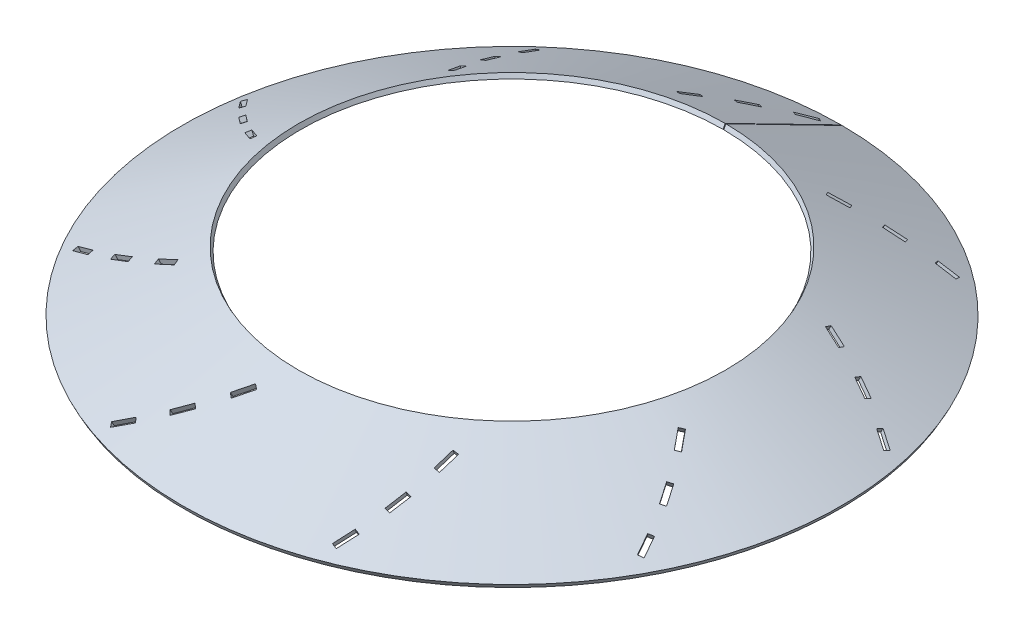
from build123d import *

# Parameters (mm, degrees)
LOFTED_BENDS1_ANGLE = 359.8
CUT_EXTRUDE1_REACH  = 314.369
CIRPATTERN1_COUNT   = 9


# Read off the part's stored shape, not the designer's step: Lofted Bends1
with BuildPart() as part:
    # Lofted Bends1 outline → Lofted Bends1 (revolve)
    with BuildSketch(Plane(origin=(0, 0, 0), x_dir=(-0.0017453283658983838, 0, -0.9999984769132877), z_dir=(0.9999984769132877, 0, -0.0017453283658983838))):
        Polygon((115, 122), (113.860654304, 119.774715437), (176.360654304, 87.774715437), (177.5, 90), align=None)
    revolve(axis=Axis((0, 0, 0), (0, 1, 0)), revolution_arc=LOFTED_BENDS1_ANGLE)

    # Cut-Extrude1: up to this cone (the profile starts outside it)
    cut_extrude1_end = Plane(origin=(0, 104.2342555, 0), z_dir=(0, -1, 0)).offset(-73.837113941) * Cone(1.953e-06, 1061.918172969, 543.70210356, align=(Align.CENTER, Align.CENTER, Align.MIN), mode=Mode.PRIVATE)
    # Sketch5 → Cut-Extrude1 (cut, up to the surface)
    with BuildSketch(Plane(origin=(-0.128074459, 143.31169819, -73.375477698), x_dir=(0.9999996836098611, 0.000708063352348728, -0.00036252788415440905), z_dir=(-0.0007954748127557475, 0.8901138250644751, -0.4557375841961153)), mode=Mode.PRIVATE) as cut_extrude1_sk1:
        with BuildLine():
            Line((-28.570167164, 66.283492897), (-31.198754648, 67.389088997))
            add(Edge.make_bspline(
                [(-31.198754648, 67.389088997), (-31.544731517, 66.589248586), (-32.229181601, 64.986258118), (-33.223373063, 62.568351769), (-34.187933349, 60.138745578), (-34.808863438, 58.51100702), (-35.115519065, 57.695645517)],
                knots=[-0.0197029, -0.0197029, -0.0197029, -0.0197029, 0.240253838, 0.500210575, 0.760167312, 1.020124049, 1.020124049, 1.020124049, 1.020124049], degree=3))
            Line((-35.115519065, 57.695645517), (-32.425888496, 56.716299785))
            add(Edge.make_bspline(
                [(-32.425888496, 56.716299785), (-32.124006107, 57.521081436), (-31.512675538, 59.127813005), (-30.563262017, 61.525473596), (-29.584683197, 63.911631841), (-28.910765007, 65.493977592), (-28.570167164, 66.283492897)],
                knots=[-0.01996023, -0.01996023, -0.01996023, -0.01996023, 0.240112304, 0.500184838, 0.760257372, 1.020329905, 1.020329905, 1.020329905, 1.020329905], degree=3))
        make_face()
        with BuildLine():
            add(Edge.make_bspline(
                [(-32.543580635, 56.971999471), (-31.381822693, 60.069104531), (-30.144633056, 63.13874309), (-28.833757426, 66.177389379)],
                knots=[0, 0, 0, 0, 1, 1, 1, 1], degree=3))
            Line((-28.833757426, 66.177389379), (-31.093794242, 67.127971333))
            add(Edge.make_bspline(
                [(-31.093794242, 67.127971333), (-32.423592475, 64.053701166), (-33.678640979, 60.947993609), (-34.857170376, 57.814421574)],
                knots=[0, 0, 0, 0, 0.999999959, 0.999999959, 0.999999959, 0.999999959], degree=3))
            Line((-34.857170376, 57.814421574), (-32.543580635, 56.971999471))
        make_face(mode=Mode.SUBTRACT)
    cut_extrude1_tool1 = extrude(cut_extrude1_sk1.sketch, amount=-CUT_EXTRUDE1_REACH, mode=Mode.PRIVATE) - cut_extrude1_end
    # Sketch5 → Cut-Extrude1 (cut, up to the surface)
    with BuildSketch(Plane(origin=(-0.128074459, 143.31169819, -73.375477698), x_dir=(0.9999996836098611, 0.000708063352348728, -0.00036252788415440905), z_dir=(-0.0007954748127557475, 0.8901138250644751, -0.4557375841961153)), mode=Mode.PRIVATE) as cut_extrude1_sk2:
        with BuildLine():
            Line((-34.857170376, 57.814421574), (-32.543580635, 56.971999471))
            add(Edge.make_bspline(
                [(-32.543580635, 56.971999471), (-31.381822693, 60.069104531), (-30.144633056, 63.13874309), (-28.833757426, 66.177389379)],
                knots=[0, 0, 0, 0, 1, 1, 1, 1], degree=3))
            Line((-28.833757426, 66.177389379), (-31.093794317, 67.127971389))
            add(Edge.make_bspline(
                [(-31.093794317, 67.127971389), (-32.423592475, 64.053701166), (-33.678640979, 60.947993609), (-34.857170376, 57.814421574)],
                knots=[0, 0, 0, 0, 0.999999959, 0.999999959, 0.999999959, 0.999999959], degree=3))
        make_face()
    cut_extrude1_tool2 = extrude(cut_extrude1_sk2.sketch, amount=-CUT_EXTRUDE1_REACH, mode=Mode.PRIVATE) - cut_extrude1_end
    # Sketch5 → Cut-Extrude1 (cut, up to the surface)
    with BuildSketch(Plane(origin=(-0.128074459, 143.31169819, -73.375477698), x_dir=(0.9999996836098611, 0.000708063352348728, -0.00036252788415440905), z_dir=(-0.0007954748127557475, 0.8901138250644751, -0.4557375841961153)), mode=Mode.PRIVATE) as cut_extrude1_sk3:
        with BuildLine():
            Line((-17.360559504, 88.371637377), (-19.805347324, 89.78014105))
            add(Edge.make_bspline(
                [(-19.805347324, 89.78014105), (-20.246571974, 89.027752072), (-21.122018783, 87.518819976), (-22.404830495, 85.238163683), (-23.659852272, 82.942340733), (-24.475709136, 81.40118354), (-24.880055401, 80.628672476)],
                knots=[-0.019733261, -0.019733261, -0.019733261, -0.019733261, 0.240222535, 0.500178332, 0.760134128, 1.020089925, 1.020089925, 1.020089925, 1.020089925], degree=3))
            Line((-24.880055401, 80.628672476), (-22.355883499, 79.338786633))
            add(Edge.make_bspline(
                [(-22.355883499, 79.338786633), (-21.957848078, 80.101313032), (-21.154650311, 81.62266385), (-19.919407951, 83.88843896), (-18.6568111, 86.139302371), (-17.794906986, 87.628904038), (-17.360559504, 88.371637377)],
                knots=[-0.019964531, -0.019964531, -0.019964531, -0.019964531, 0.24009209, 0.500148711, 0.760205331, 1.020261952, 1.020261952, 1.020261952, 1.020261952], degree=3))
        make_face()
        with BuildLine():
            add(Edge.make_bspline(
                [(-22.441431756, 79.607103458), (-20.90954734, 82.541772702), (-19.306586955, 85.440120752), (-17.634824771, 88.298830796)],
                knots=[0, 0, 0, 0, 1, 1, 1, 1], degree=3))
            Line((-17.634824771, 88.298830796), (-19.733220994, 89.507769555))
            add(Edge.make_bspline(
                [(-19.733220994, 89.507769555), (-21.429111483, 86.61588826), (-23.055206641, 83.683799043), (-24.60920148, 80.714862987)],
                knots=[0, 0, 0, 0, 0.99999996, 0.99999996, 0.99999996, 0.99999996], degree=3))
            Line((-24.60920148, 80.714862987), (-22.441431756, 79.607103458))
        make_face(mode=Mode.SUBTRACT)
    cut_extrude1_tool3 = extrude(cut_extrude1_sk3.sketch, amount=-CUT_EXTRUDE1_REACH, mode=Mode.PRIVATE) - cut_extrude1_end
    # Sketch5 → Cut-Extrude1 (cut, up to the surface)
    with BuildSketch(Plane(origin=(-0.128074459, 143.31169819, -73.375477698), x_dir=(0.9999996836098611, 0.000708063352348728, -0.00036252788415440905), z_dir=(-0.0007954748127557475, 0.8901138250644751, -0.4557375841961153)), mode=Mode.PRIVATE) as cut_extrude1_sk4:
        with BuildLine():
            Line((-24.60920148, 80.714862987), (-22.441431756, 79.607103458))
            add(Edge.make_bspline(
                [(-22.441431756, 79.607103458), (-20.90954734, 82.541772702), (-19.306586955, 85.440120752), (-17.634824771, 88.298830796)],
                knots=[0, 0, 0, 0, 1, 1, 1, 1], degree=3))
            Line((-17.634824771, 88.298830796), (-19.733221089, 89.507769623))
            add(Edge.make_bspline(
                [(-19.733221089, 89.507769623), (-21.429111483, 86.61588826), (-23.055206641, 83.683799043), (-24.60920148, 80.714862987)],
                knots=[0, 0, 0, 0, 0.99999996, 0.99999996, 0.99999996, 0.99999996], degree=3))
        make_face()
    cut_extrude1_tool4 = extrude(cut_extrude1_sk4.sketch, amount=-CUT_EXTRUDE1_REACH, mode=Mode.PRIVATE) - cut_extrude1_end
    # Sketch5 → Cut-Extrude1 (cut, up to the surface)
    with BuildSketch(Plane(origin=(-0.128074459, 143.31169819, -73.375477698), x_dir=(0.9999996836098611, 0.000708063352348728, -0.00036252788415440905), z_dir=(-0.0007954748127557475, 0.8901138250644751, -0.4557375841961153)), mode=Mode.PRIVATE) as cut_extrude1_sk5:
        with BuildLine():
            Line((-3.756065704, 108.659711749), (-5.97662808, 110.34475206))
            add(Edge.make_bspline(
                [(-5.97662808, 110.34475206), (-6.505403183, 109.650523835), (-7.556527462, 108.257178215), (-9.105486907, 106.146285831), (-10.628915952, 104.017008165), (-11.625344755, 102.584413203), (-12.120240383, 101.865790302)],
                knots=[-0.019840584, -0.019840584, -0.019840584, -0.019840584, 0.240118506, 0.500077596, 0.760036686, 1.019995776, 1.019995776, 1.019995776, 1.019995776], degree=3))
            Line((-12.120240383, 101.865790302), (-9.803146063, 100.289836572))
            add(Edge.make_bspline(
                [(-9.803146063, 100.289836572), (-9.316000243, 100.999226664), (-8.335105621, 102.413536396), (-6.835789669, 104.515143394), (-5.311341924, 106.598672886), (-4.27657254, 107.974318949), (-3.756065704, 108.659711749)],
                knots=[-0.02003797, -0.02003797, -0.02003797, -0.02003797, 0.240004788, 0.500047545, 0.760090303, 1.020133061, 1.020133061, 1.020133061, 1.020133061], degree=3))
        make_face()
        with BuildLine():
            add(Edge.make_bspline(
                [(-9.855303556, 100.567186547), (-7.980336313, 103.297545977), (-6.039759441, 105.983281063), (-4.036346488, 108.621334428)],
                knots=[0, 0, 0, 0, 1, 1, 1, 1], degree=3))
            Line((-4.036346488, 108.621334428), (-5.938491543, 110.064748551))
            add(Edge.make_bspline(
                [(-5.938491543, 110.064748551), (-7.970816688, 107.396511203), (-9.93939803, 104.679906085), (-11.841424475, 101.918031286)],
                knots=[0, 0, 0, 0, 0.999999961, 0.999999961, 0.999999961, 0.999999961], degree=3))
            Line((-11.841424475, 101.918031286), (-9.855303556, 100.567186547))
        make_face(mode=Mode.SUBTRACT)
    cut_extrude1_tool5 = extrude(cut_extrude1_sk5.sketch, amount=-CUT_EXTRUDE1_REACH, mode=Mode.PRIVATE) - cut_extrude1_end
    # Sketch5 → Cut-Extrude1 (cut, up to the surface)
    with BuildSketch(Plane(origin=(-0.128074459, 143.31169819, -73.375477698), x_dir=(0.9999996836098611, 0.000708063352348728, -0.00036252788415440905), z_dir=(-0.0007954748127557475, 0.8901138250644751, -0.4557375841961153)), mode=Mode.PRIVATE) as cut_extrude1_sk6:
        with BuildLine():
            Line((-11.841424475, 101.918031286), (-9.855303556, 100.567186547))
            add(Edge.make_bspline(
                [(-9.855303556, 100.567186547), (-7.980336313, 103.297545977), (-6.039759441, 105.983281063), (-4.036346488, 108.621334428)],
                knots=[0, 0, 0, 0, 1, 1, 1, 1], degree=3))
            Line((-4.036346488, 108.621334428), (-5.938491654, 110.064748635))
            add(Edge.make_bspline(
                [(-5.938491654, 110.064748635), (-7.970816688, 107.396511203), (-9.93939803, 104.679906085), (-11.841424475, 101.918031286)],
                knots=[0, 0, 0, 0, 0.999999961, 0.999999961, 0.999999961, 0.999999961], degree=3))
        make_face()
    cut_extrude1_tool6 = extrude(cut_extrude1_sk6.sketch, amount=-CUT_EXTRUDE1_REACH, mode=Mode.PRIVATE) - cut_extrude1_end
    cut_extrude1 = cut_extrude1_tool1.solids().sort_by_distance((-30.061067, 112.88328, -132.753826))[0] + cut_extrude1_tool2.solids().sort_by_distance((-32.001148, 115.01713, -128.582757))[0] + cut_extrude1_tool3.solids().sort_by_distance((-18.775255, 102.754063, -152.557182))[0] + cut_extrude1_tool4.solids().sort_by_distance((-21.27207, 104.764583, -148.626021))[0] + cut_extrude1_tool5.solids().sort_by_distance((-5.073482, 93.451381, -170.750426))[0] + cut_extrude1_tool6.solids().sort_by_distance((-8.083128, 95.31067, -167.113744))[0]
    add(cut_extrude1, mode=Mode.SUBTRACT)

    # CirPattern1: Cut-Extrude1 ×9 about axis
    cirpattern1_axis = Axis((0, 0, 0), (0, -1, 0))
    for i in range(1, CIRPATTERN1_COUNT):
        add(cut_extrude1.rotate(cirpattern1_axis, i * 360 / CIRPATTERN1_COUNT), mode=Mode.SUBTRACT)


solid = part.part
